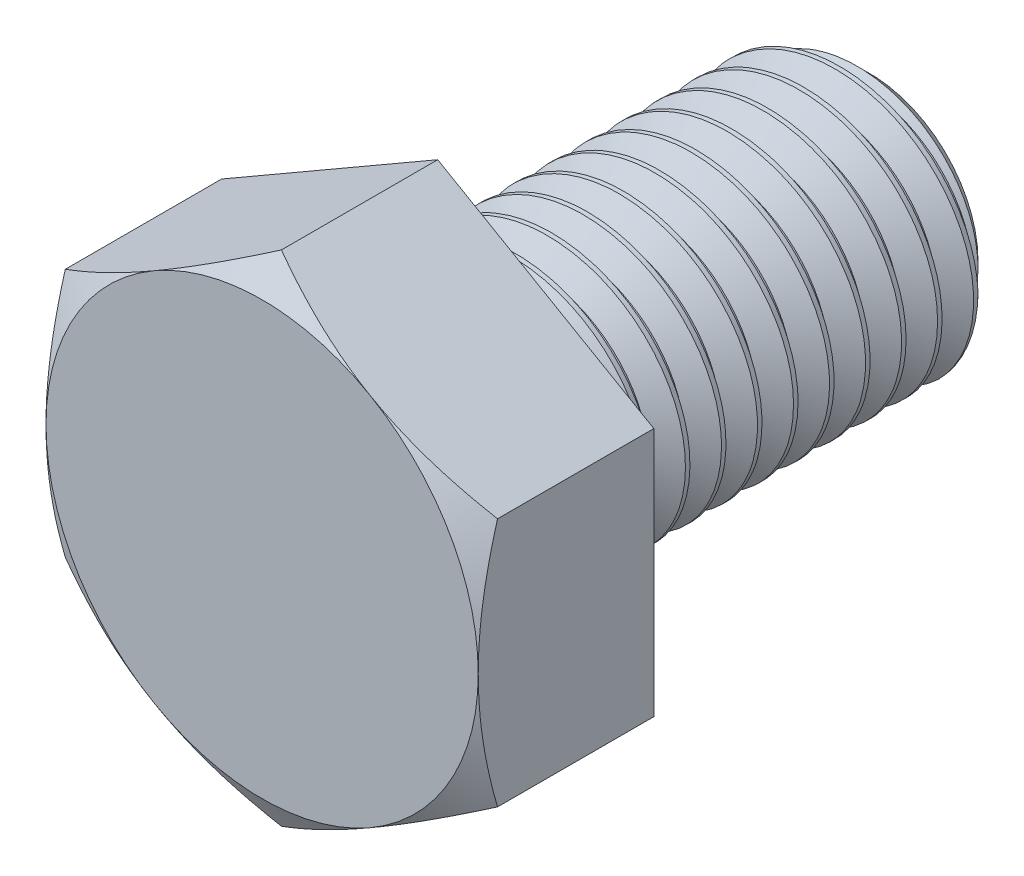
from build123d import *

# Parameters (mm, degrees)
SKETCH2_W           = 12.7
SKETCH2_H           = 3.96875
BOSS_EXTRUDE1_DEPTH = 5.159375
CHAMFER1_SIZE       = 0.79375
SKETCH4_OUTSIDE_W   = 93.84
SKETCH4_OUTSIDE_H   = 95.804
SKETCH4_OUTSIDE_R   = 6.35
CUT_EXTRUDE1_DEPTH  = 21.323462026
CUT_EXTRUDE1_DRAFT  = -60
CUT_SWEEP1_PITCH    = 1.058333333
CUT_SWEEP1_TO       = 12.7


with BuildPart() as part:
    # Sketch2 → Revolve1 (revolve)
    with BuildSketch(Plane(origin=(0, 0, 0), x_dir=(0, 0, -1), z_dir=(1, 0, 0)), mode=Mode.PRIVATE) as revolve1_sk:
        with Locations((6.35, 1.984375)):
            Rectangle(SKETCH2_W, SKETCH2_H)
    revolve(revolve1_sk.sketch.rotate(Axis((0, 0, 0), (0, 0, -1)), 90), axis=Axis((0, 0, 0), (0, 0, -1)))

    # Sketch3 → Boss-Extrude1 (add)
    with BuildSketch(Plane.XY):
        Polygon((0, 7.332348419), (-6.35, 3.666174209), (-6.35, -3.666174209), (0, -7.332348419), (6.35, -3.666174209), (6.35, 3.666174209), align=None)
    extrude(amount=BOSS_EXTRUDE1_DEPTH)

    # Chamfer1
    chamfer1_edges = [part.edges().sort_by_distance(p)[0] for p in [
        (-3.96875, 0, -12.7),
    ]]
    chamfer(chamfer1_edges, length=CHAMFER1_SIZE)


with BuildPart() as cut_extrude1_tool:
    # Sketch4 outside → Cut-Extrude1 (with draft: the straight prism first)
    with BuildSketch(Plane.XY.offset(5.159375)):
        Rectangle(SKETCH4_OUTSIDE_W, SKETCH4_OUTSIDE_H)
        Circle(SKETCH4_OUTSIDE_R, mode=Mode.SUBTRACT)
    extrude(amount=-CUT_EXTRUDE1_DEPTH)
    # Cut-Extrude1: the draft: its side faces are tilted about the plane it starts from
    cut_extrude1_sides = [cut_extrude1_tool.faces().sort_by_distance(p)[0] for p in [
        (0, -47.902, -5.502356013),
        (46.92, 0, -5.502356013),
        (0, 47.902, -5.502356013),
        (-46.92, 0, -5.502356013),
        (-6.35, 0, -5.502356013),
    ]]
    draft(cut_extrude1_sides, Plane.XY.offset(5.159375), CUT_EXTRUDE1_DRAFT)


with BuildPart() as part_1:
    add(part.part)

    # Cut-Extrude1: cut by cut_extrude1_tool
    add(cut_extrude1_tool.part, mode=Mode.SUBTRACT)


with BuildPart() as body_2:
    # Split1: read off the stored shape, not the designer's step
    # Split1: the piece on the far side of the plane
    add(part_1.part)
    split(bisect_by=Plane.XY, keep=Keep.BOTTOM)

    # Cut-Sweep1: arcs per turn and ends read off the stored shape
    # Cut-Sweep1: the profile of Sketch5 screwed along a right-hand helix through 13 turns, 8 arcs to a turn; built about Z, then put on its axis
    cut_sweep1_z = Axis((0, 0, 0), (0, 0, 1))
    cut_sweep1_corners = [(4.026033972, 0, 0.033072917), (4.026033972, 0, -0.959114583), (3.281342336, 0, -0.529166667), (3.281342336, 0, -0.396875)]
    with BuildLine(mode=Mode.PRIVATE) as cut_sweep1_profile:
        Line(cut_sweep1_corners[0], cut_sweep1_corners[1])
        Line(cut_sweep1_corners[1], cut_sweep1_corners[2])
        Line(cut_sweep1_corners[2], cut_sweep1_corners[3])
        Line(cut_sweep1_corners[3], cut_sweep1_corners[0])
    cut_sweep1_cap = Face(cut_sweep1_profile.wire())
    cut_sweep1_turn_angles = [0, 22.5, 45, 67.5, 90, 112.5, 135, 157.5, 180, 202.5, 225, 247.5, 270, 292.5, 315, 337.5, 360]
    cut_sweep1_turn_weights = [1, 0.9238795325112867, 1, 0.9238795325112867, 1, 0.9238795325112867, 1, 0.9238795325112867, 1, 0.9238795325112867, 1, 0.9238795325112867, 1, 0.9238795325112867, 1, 0.9238795325112867, 1]
    cut_sweep1_turn_rails = [Edge.make_bspline([Vector(p[0], p[1], 0).rotate(cut_sweep1_z, cut_sweep1_turn_angles[k]) / cut_sweep1_turn_weights[k] + Vector(0, 0, p[2] + CUT_SWEEP1_PITCH * cut_sweep1_turn_angles[k] / 360) for k in range(17)], [0, 0, 0, 1, 1, 2, 2, 3, 3, 4, 4, 5, 5, 6, 6, 7, 7, 8, 8, 8], 2, cut_sweep1_turn_weights) for p in cut_sweep1_corners]
    cut_sweep1_turn_sides = [Face.make_surface_from_curves(cut_sweep1_turn_rails[p[0]], cut_sweep1_turn_rails[p[1]]) for p in [(0, 1), (1, 2), (2, 3), (3, 0)]]
    cut_sweep1 = Plane(origin=(0, 0, -12.7), x_dir=(0, 1, 0), z_dir=(0, 0, 1)) * split(Solid(Shell([*[p.moved(Location((0, 0, CUT_SWEEP1_PITCH * i))) for i in range(13) for p in cut_sweep1_turn_sides], cut_sweep1_cap, cut_sweep1_cap.rotate(cut_sweep1_z, 4680).moved(Location((0, 0, CUT_SWEEP1_PITCH * 4680 / 360)))])), bisect_by=Plane.XY.offset(CUT_SWEEP1_TO), keep=Keep.BOTTOM, mode=Mode.PRIVATE)
    add(cut_sweep1, mode=Mode.SUBTRACT)


with BuildPart() as part_2:
    add(part_1.part)

    # Split1
    split(bisect_by=Plane.XY, keep=Keep.TOP)

    # Combine1: union body 2
    add(body_2.part)


solid = part_2.part
